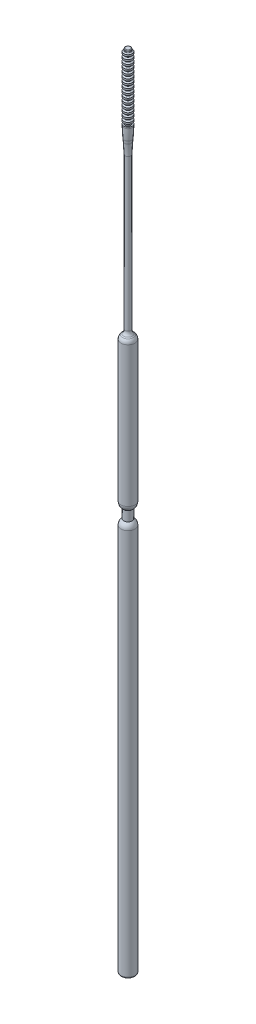
from build123d import *

# Parameters (mm, degrees)
SKETCH2_R           = 0.5
BOSS_EXTRUDE1_DEPTH = 5
FILLET1_R           = 20
BOSS_EXTRUDE3_DEPTH = 1
MOVE_FACE1_BY       = 0.25
BOSS_EXTRUDE4_START = 21.5
SKETCH8_R           = 0.5
BOSS_EXTRUDE4_DEPTH = 21.5
FILLET6_R           = 0.25
FILLET7_R           = 1
LPATTERN1_COUNT     = 15
LPATTERN1_PITCH     = 0.75
FILLET8_R           = 0.1


with BuildPart() as part:
    # Sketch2 → Boss-Extrude1 (new body)
    with BuildSketch(Plane(origin=(0, 0, 0), x_dir=(1, 0, 0), z_dir=(0, 1, 0))):
        with Locations(Location((0, 0, 0), (0, 0, 270))):
            Circle(SKETCH2_R)
    extrude(amount=BOSS_EXTRUDE1_DEPTH)

    # Sketch4 → Revolve1 (revolve)
    with BuildSketch(Plane(origin=(0, 0, 0), x_dir=(0, 0, -1), z_dir=(1, 0, 0))):
        Polygon((0, 5.000000000000001), (0, 10.500000000000002), (0.75, 10.500000000000002), (0.7500000000000002, 9.000000000000002), (0.5, 6.500000000000001), (0.5, 5.000000000000001), align=None)
    revolve(axis=Axis((0, 5.000000000000001, 0), (0, 1, 0)))

    # Fillet1
    # the kernel refuses this fillet: 20 mm, written as the material it adds along each edge
    with BuildSketch(Plane(origin=(0, 6.500000000000001, 0), x_dir=(0, 0, -1), z_dir=(1, 0, 0))) as fillet1_piece_1:
        with BuildLine():
            CenterArc((0.5 + FILLET1_R, -FILLET1_R * 0.0498756211209), FILLET1_R, 174.28940686250036, 5.710593137499643)
            Line((0.5 + FILLET1_R * 0.00496280979001, FILLET1_R * 0.0496280979001), (0.5, 0))
            Line((0.5, 0), (0.5, -FILLET1_R * 0.0498756211209))
        make_face()
    revolve(axis=Axis((0, 6.500000000000001, 0), (0, 1, 0)))
    # the kernel refuses this fillet: 20 mm, written as the material it takes off along each edge
    with BuildSketch(Plane(origin=(0, 9.000000000000002, 0), x_dir=(0, 0, -1), z_dir=(1, 0, 0))) as fillet1_2_piece_1:
        with BuildLine():
            CenterArc((0.7500000000000002 - FILLET1_R, FILLET1_R * 0.0498756211209), FILLET1_R, 354.28940686250036, 5.710593137499647)
            Line((0.75, FILLET1_R * 0.0498756211209), (0.7500000000000002, 0))
            Line((0.7500000000000002, 0), (0.7500000000000002 - FILLET1_R * 0.00496280979001, -FILLET1_R * 0.0496280979001))
        make_face()
    revolve(axis=Axis((0, 9.000000000000002, 0), (0, 1, 0)), mode=Mode.SUBTRACT)

    # Sketch5 → Boss-Extrude3 (add)
    with BuildSketch(Plane(origin=(0, 10.500000000000002, 0), x_dir=(1, 0, 0), z_dir=(0, 1, 0))):
        with BuildLine():
            ThreePointArc((0.12499999999999366, 0.48412291827592874), (-1.329e-14, 0.5), (-0.1250000000000195, 0.4841229182759221))
            Line((-0.12500000000000006, 0.48412291827591764), (-0.12500000000000003, 0.125))
            Line((-0.125, 0.125), (0.125, 0.125))
            Line((0.12499999999999999, 0.125), (0.12499999999999994, 0.4841229182759302))
        make_face()
        with BuildLine():
            Line((0.48412291827592446, 0.125), (0.125, 0.125))
            Line((0.12499999999999999, 0.125), (0.12500000000000003, -0.125))
            Line((0.125, -0.125), (0.48412291827592446, -0.125))
            ThreePointArc((0.48412291827592574, -0.12500000000000536), (0.49601484813358304, -0.06300214624136663), (0.5, -1.2e-16))
            ThreePointArc((0.5, 0), (0.496014848133583, 0.06300214624136691), (0.4841229182759257, 0.12500000000000558))
        make_face()
        with BuildLine():
            ThreePointArc((0.4841229182759257, 0.12500000000000558), (0.3535533905932694, 0.35355339059327817), (0.12499999999999366, 0.48412291827592874))
            Line((0.12499999999999994, 0.4841229182759302), (0.12499999999999999, 0.125))
            Line((0.125, 0.125), (0.48412291827592446, 0.125))
        make_face()
        with BuildLine():
            Line((0.48412291827592446, -0.125), (0.125, -0.125))
            Line((0.12500000000000003, -0.125), (0.12500000000000006, -0.48412291827593024))
            ThreePointArc((0.12499999999999353, -0.4841229182759288), (0.3535533905932696, -0.3535533905932779), (0.48412291827592574, -0.12500000000000536))
        make_face()
        with BuildLine():
            Line((0.125, -0.125), (-0.125, -0.125))
            Line((-0.12499999999999999, -0.125), (-0.12499999999999994, -0.4841229182759178))
            ThreePointArc((-0.1250000000000195, -0.4841229182759221), (-1.341e-14, -0.5), (0.12499999999999353, -0.4841229182759288))
            Line((0.12500000000000006, -0.48412291827593024), (0.12500000000000003, -0.125))
        make_face()
        Polygon((0.125, 0.125), (-0.125, 0.125), (-0.12499999999999999, -0.125), (0.125, -0.125), align=None)
        with BuildLine():
            Line((-0.12499999999999999, -0.125), (-0.12500000000000003, 0.125))
            Line((-0.125, 0.125), (-0.48412291827591875, 0.125))
            ThreePointArc((-0.48412291827592263, 0.12500000000001735), (-0.5, 6e-17), (-0.4841229182759227, -0.1250000000000172))
            Line((-0.48412291827591875, -0.125), (-0.125, -0.125))
        make_face()
        with BuildLine():
            Line((-0.12500000000000003, 0.125), (-0.12500000000000006, 0.48412291827591764))
            ThreePointArc((-0.1250000000000195, 0.4841229182759221), (-0.3535533905932745, 0.353553390593273), (-0.48412291827592263, 0.12500000000001735))
            Line((-0.48412291827591875, 0.125), (-0.125, 0.125))
        make_face()
        with BuildLine():
            Line((-0.12499999999999994, -0.4841229182759178), (-0.12499999999999999, -0.125))
            Line((-0.125, -0.125), (-0.48412291827591875, -0.125))
            ThreePointArc((-0.4841229182759227, -0.1250000000000172), (-0.3535533905932746, -0.3535533905932729), (-0.1250000000000195, -0.4841229182759221))
        make_face()
    boss_extrude3 = extrude(amount=BOSS_EXTRUDE3_DEPTH)

    # Sketch10 → Revolve5 (revolve)
    with BuildSketch(Plane.XY):
        Polygon((0, 11.500000000000004), (0.7500000000000002, 10.974844346342728), (0.75, 10.669650699152365), (5e-17, 11.19480635280964), align=None)
    revolve5 = revolve(axis=Axis((0, 11.500000000000004, 0), (1.8e-16, -1, 0)))

    # Move Face1: a face moved inward by 0.25
    extrude(part.faces().sort_by_distance((0.6, 10.5, 0))[0], amount=MOVE_FACE1_BY, dir=(0, -1, 0), mode=Mode.SUBTRACT)

    # Sketch8 → Boss-Extrude4 (add)
    with BuildSketch(Plane(origin=(0, 0, 0), x_dir=(-1, 0, 0), z_dir=(0, -1, 0)).offset(BOSS_EXTRUDE4_START)):
        with Locations(Location((0, 0, 0), (0, 0, 180))):
            Circle(SKETCH8_R)
    extrude(amount=-BOSS_EXTRUDE4_DEPTH)

    # Sketch9 → Revolve4 (revolve)
    with BuildSketch(Plane.XY, mode=Mode.PRIVATE) as revolve4_sk:
        with BuildLine():
            Line((0, -21.5), (-0.5, -21.5))
            Line((-0.5, -21.5), (-0.4999999999999998, -22))
            Line((-0.4999999999999998, -22), (-1.2499999999999998, -22.75))
            Line((-1.2499999999999998, -22.75), (-1.2499999999999998, -23.25))
            Line((-1.2499999999999998, -23.25), (-1.2499999999999967, -48.25))
            ThreePointArc((-1.249999999999998, -48.25), (-1.1180339887498931, -48.80901699437494), (-0.7499999999999993, -49.24999999999999))
            Line((-0.7499999999999999, -49.24999999999999), (-0.7499999999999997, -51.00000000000001))
            ThreePointArc((-0.7499999999999996, -51.00000000000001), (-1.1180339887498953, -51.44098300562506), (-1.2499999999999964, -52.00000000000001))
            Line((-1.2499999999999964, -52.00000000000001), (-1.2499999999999876, -120.25))
            Line((-1.2499999999999876, -120.25000000000001), (-1.2499999999999878, -121.50000000000001))
            Line((-1.2499999999999878, -121.50000000000001), (0, -121.50000000000001))
            Line((0, -121.5), (0, -52.00000000000001))
            Line((4.6e-16, -52.00000000000001), (0, -48.25))
            Line((0, -48.25), (0, -21.5))
        make_face()
    revolve(revolve4_sk.sketch.rotate(Axis((0, -21.5, 0), (0, -1, 0)), 270), axis=Axis((0, -21.5, 0), (0, -1, 0)))

    # Fillet6
    fillet6_edges = [part.edges().sort_by_distance(p)[0] for p in [
        (-4.3e-16, -121.50000000000001, -1.2499999999999878),
    ]]
    fillet(fillet6_edges, radius=FILLET6_R)

    # Fillet7
    fillet7_edges = [part.edges().sort_by_distance(p)[0] for p in [
        (-1.7e-16, -22, -0.4999999999999998),
        (-4.3e-16, -22.75, -1.2499999999999998),
    ]]
    fillet(fillet7_edges, radius=FILLET7_R)

    # LPattern1: Boss-Extrude3, Revolve5 ×15
    with Locations(*[(0, i * LPATTERN1_PITCH, 0) for i in range(1, LPATTERN1_COUNT)]):
        add(boss_extrude3)
        add(revolve5)

    # Fillet8
    fillet8_edges = [part.edges().sort_by_distance(p)[0] for p in [
        (0.3061862178478884, 21.649896230895155, -0.39528470752105255),
        (0.125000000000012, 22, 0.48412291827592546),
    ]]
    fillet(fillet8_edges, radius=FILLET8_R)


solid = part.part
